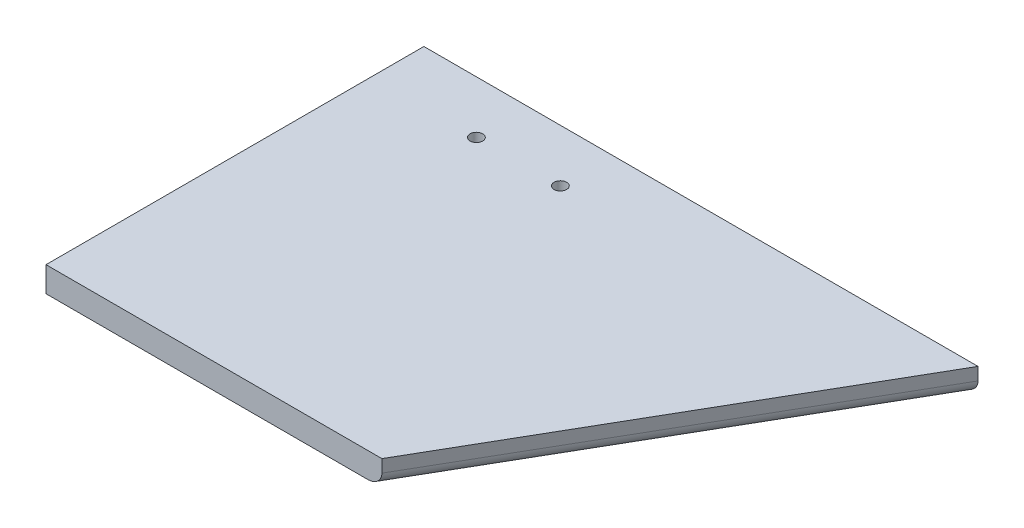
from build123d import *

# Parameters (mm, degrees)
BOSS_EXTRUDE1_DEPTH = 6
FILLET1_R           = 3
SKETCH2_R           = 1.5
CUT_EXTRUDE1_DEPTH  = 121.565334985


with BuildPart() as part:
    # Sketch1 → Boss-Extrude1 (new body)
    with BuildSketch(Plane(origin=(0, 0, 0), x_dir=(1, 0, 0), z_dir=(0, 1, 0))):
        Polygon((0, 0), (51.961524227, 90), (0, 90), (-80, 90), (-80, 0), align=None)
    extrude(amount=BOSS_EXTRUDE1_DEPTH)

    # Fillet1
    fillet1_edges = [part.edges().sort_by_distance(p)[0] for p in [
        (25.980762114, 0, -45),
    ]]
    fillet(fillet1_edges, radius=FILLET1_R)

    # Sketch2 → Cut-Extrude1 (cut, through all)
    with BuildSketch(Plane(origin=(0, 6, 0), x_dir=(1, 0, 0), z_dir=(0, 1, 0))):
        with Locations((-55, 77.5)):
            Circle(SKETCH2_R)
        with Locations((-35, 77.5)):
            Circle(SKETCH2_R)
    extrude(amount=-CUT_EXTRUDE1_DEPTH, mode=Mode.SUBTRACT)


solid = part.part
